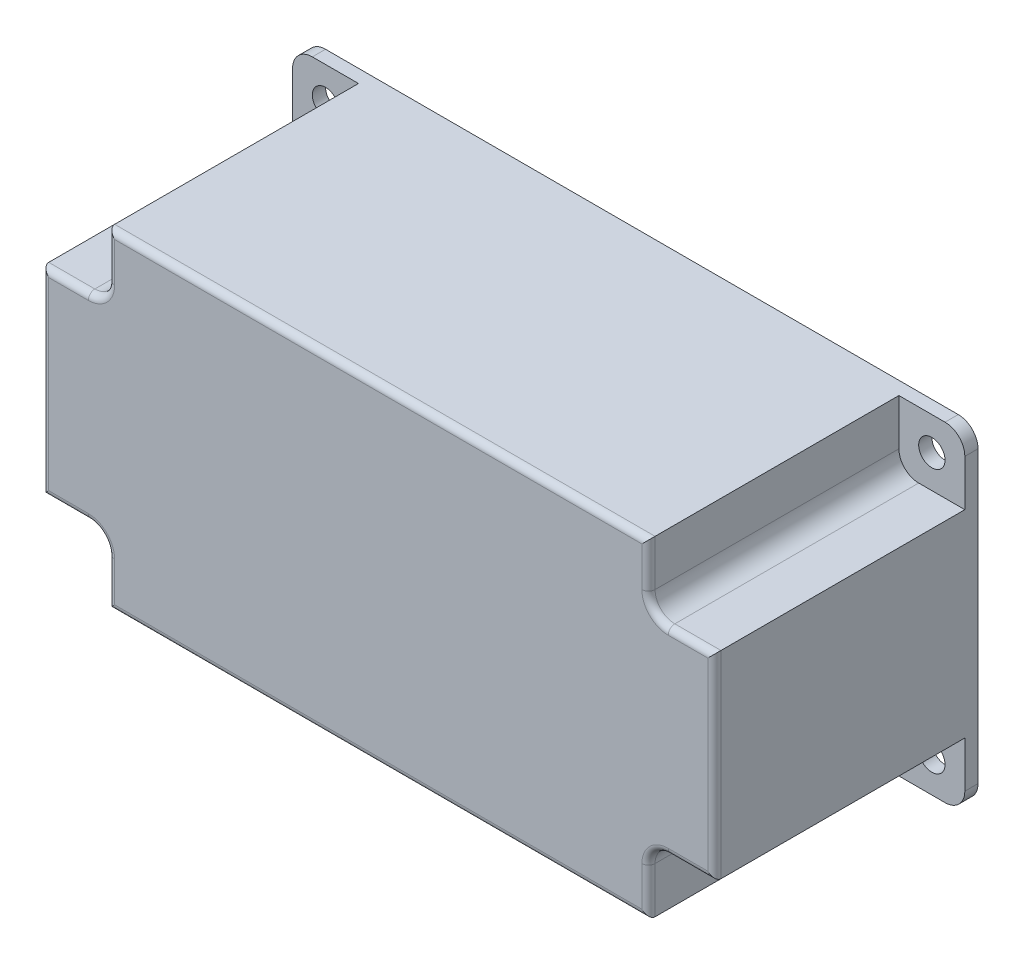
from build123d import *

# Parameters (mm, degrees)
CROQUIS1_W              = 102
CROQUIS1_H              = 50
SALIENTE_EXTRUIR1_DEPTH = 40
CORTAR_EXTRUIR1_DEPTH   = 38
CROQUIS4_R              = 2
CORTAR_EXTRUIR2_DEPTH   = 18
REDONDEO1_R             = 1
CORTAR_EXTRUIR3_DEPTH   = 38
CROQUIS6_R              = 10
CORTAR_EXTRUIR4_DEPTH   = 10


with BuildPart() as part:
    # Croquis1 → Saliente-Extruir1 (new body)
    with BuildSketch(Plane.XY):
        Rectangle(CROQUIS1_W, CROQUIS1_H)
    extrude(amount=SALIENTE_EXTRUIR1_DEPTH)

    # Croquis3 → Cortar-Extruir1 (cut)
    with BuildSketch(Plane.XY.offset(40)):
        with BuildLine():
            Line((-44, -15), (-51, -15))
            Line((-51, -15), (-51, -25))
            Line((-51, -25), (-41, -25))
            Line((-41, -25), (-41, -18))
            ThreePointArc((-41, -18), (-41.878679656, -15.878679656), (-44, -15))
        make_face()
        with BuildLine():
            Line((-51, 25), (-51, 15))
            Line((-51, 15), (-44, 15))
            ThreePointArc((-44, 15), (-41.878679656, 15.878679656), (-41, 18))
            Line((-41, 18), (-41, 25))
            Line((-41, 25), (-51, 25))
        make_face()
        with BuildLine():
            Line((41, -18), (41, -25))
            Line((41, -25), (51, -25))
            Line((51, -25), (51, -15))
            Line((51, -15), (44, -15))
            ThreePointArc((44, -15), (41.878679656, -15.878679656), (41, -18))
        make_face()
        with BuildLine():
            Line((51, 25), (41, 25))
            Line((41, 25), (41, 18))
            ThreePointArc((41, 18), (41.878679656, 15.878679656), (44, 15))
            Line((44, 15), (51, 15))
            Line((51, 15), (51, 25))
        make_face()
    extrude(amount=-CORTAR_EXTRUIR1_DEPTH, mode=Mode.SUBTRACT)

    # Croquis4 → Cortar-Extruir2 (cut)
    with BuildSketch(Plane.XY.offset(2)):
        with BuildLine():
            Line((-51, -25), (-48, -25))
            ThreePointArc((-48, -25), (-50.121320344, -24.121320344), (-51, -22))
            Line((-51, -22), (-51, -25))
        make_face()
        with BuildLine():
            ThreePointArc((51, -22), (50.121320344, -24.121320344), (48, -25))
            Line((48, -25), (51, -25))
            Line((51, -25), (51, -22))
        make_face()
        with BuildLine():
            Line((-51, 25), (-51, 22))
            ThreePointArc((-51, 22), (-50.121320344, 24.121320344), (-48, 25))
            Line((-48, 25), (-51, 25))
        make_face()
        with BuildLine():
            ThreePointArc((48, 25), (50.121320344, 24.121320344), (51, 22))
            Line((51, 22), (51, 25))
            Line((51, 25), (48, 25))
        make_face()
        with Locations((-46, 20)):
            Circle(CROQUIS4_R)
        with Locations((-46, -20)):
            Circle(CROQUIS4_R)
        with Locations((46, -20)):
            Circle(CROQUIS4_R)
        with Locations((46, 20)):
            Circle(CROQUIS4_R)
    extrude(amount=-CORTAR_EXTRUIR2_DEPTH, mode=Mode.SUBTRACT)

    # Redondeo1
    redondeo1_edges = [part.edges().sort_by_distance(p)[0] for p in [
        (-41.878679656, 15.878679656, 40),
        (-41, 21.5, 40),
        (0, 25, 40),
        (41, 21.5, 40),
        (41.878679656, 15.878679656, 40),
        (47.5, 15, 40),
        (51, 0, 40),
        (47.5, -15, 40),
        (41.878679656, -15.878679656, 40),
        (41, -21.5, 40),
        (0, -25, 40),
        (-41, -21.5, 40),
        (-41.878679656, -15.878679656, 40),
        (-47.5, -15, 40),
        (-51, 0, 40),
        (-47.5, 15, 40),
    ]]
    fillet(redondeo1_edges, radius=REDONDEO1_R)

    # Croquis5 → Cortar-Extruir3 (cut)
    with BuildSketch(Plane(origin=(0, 0, 0), x_dir=(-1, 0, 0), z_dir=(0, 0, -1))):
        with BuildLine():
            Line((0, 23.5), (-39.490487895, 23.5))
            Line((-39.490487895, 23.5), (-39.490487895, 15.5))
            ThreePointArc((-39.490487895, 15.5), (-40.076274332, 14.085786438), (-41.490487895, 13.5))
            Line((-41.490487895, 13.5), (-49.525351845, 13.5))
            Line((-49.525351845, 13.5), (-49.525351845, -13.472151698))
            Line((-49.525351845, -13.472151698), (-41.490487895, -13.472151698))
            ThreePointArc((-41.490487895, -13.472151698), (-40.076274332, -14.057938136), (-39.490487895, -15.472151698))
            Line((-39.490487895, -15.472151698), (-39.490487895, -23.5))
            Line((-39.490487895, -23.5), (39.5, -23.5))
            Line((39.5, -23.5), (39.5, -15.472151698))
            ThreePointArc((39.5, -15.472151698), (40.085786438, -14.057938136), (41.5, -13.472151698))
            Line((41.5, -13.472151698), (49.474648155, -13.472151698))
            Line((49.474648155, -13.472151698), (49.474648155, 13.5))
            Line((49.474648155, 13.5), (41.5, 13.5))
            ThreePointArc((41.5, 13.5), (40.085786438, 14.085786438), (39.5, 15.5))
            Line((39.5, 15.5), (39.5, 23.5))
            Line((39.5, 23.5), (0, 23.5))
        make_face()
    extrude(amount=-CORTAR_EXTRUIR3_DEPTH, mode=Mode.SUBTRACT)

    # Croquis6 → Cortar-Extruir4 (cut)
    with BuildSketch(Plane.ZY.offset(51)):
        with Locations((19.228570786, 0)):
            Circle(CROQUIS6_R)
    extrude(amount=-CORTAR_EXTRUIR4_DEPTH, mode=Mode.SUBTRACT)


solid = part.part
